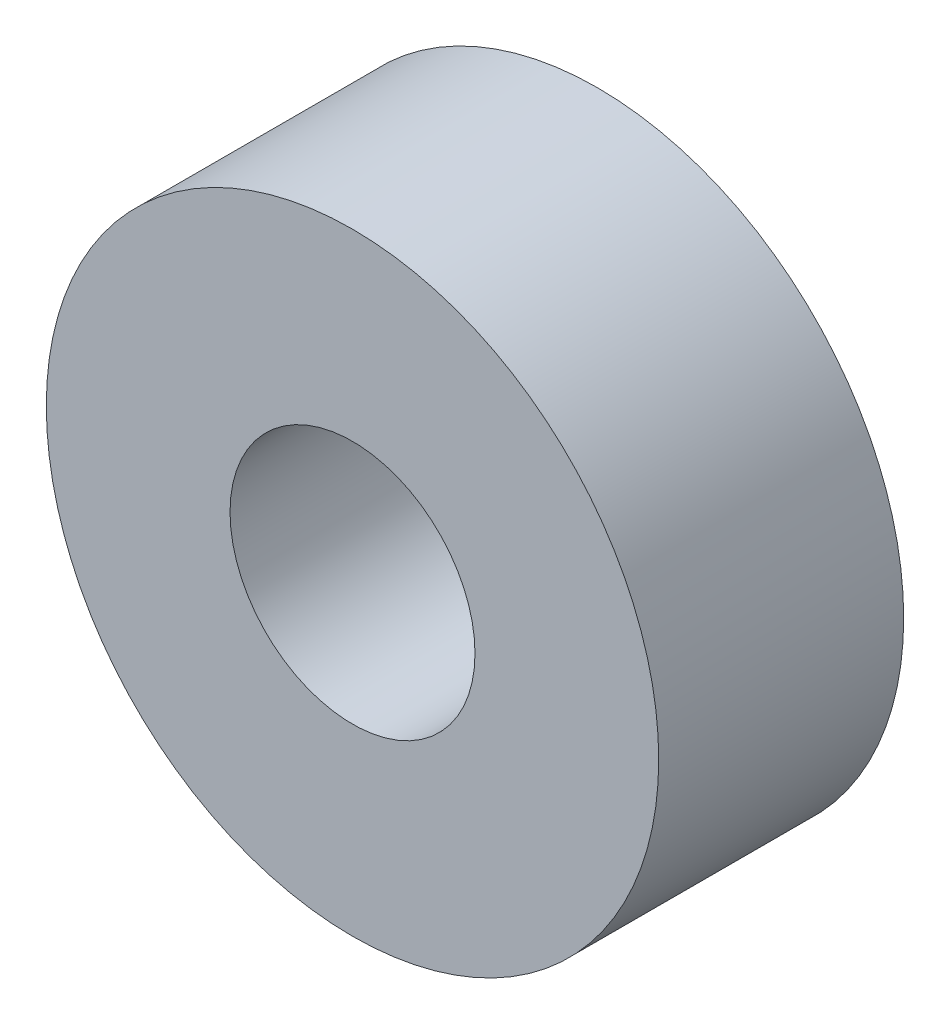
from build123d import *

# Parameters (mm, degrees)
SKETCH1_R           = 7.9375
SKETCH1_R_2         = 3.175
BOSS_EXTRUDE1_DEPTH = 6.35


with BuildPart() as part:
    # Sketch1 → Boss-Extrude1 (new body)
    with BuildSketch(Plane.XY):
        Circle(SKETCH1_R)
        Circle(SKETCH1_R_2, mode=Mode.SUBTRACT)
    extrude(amount=BOSS_EXTRUDE1_DEPTH)


solid = part.part
